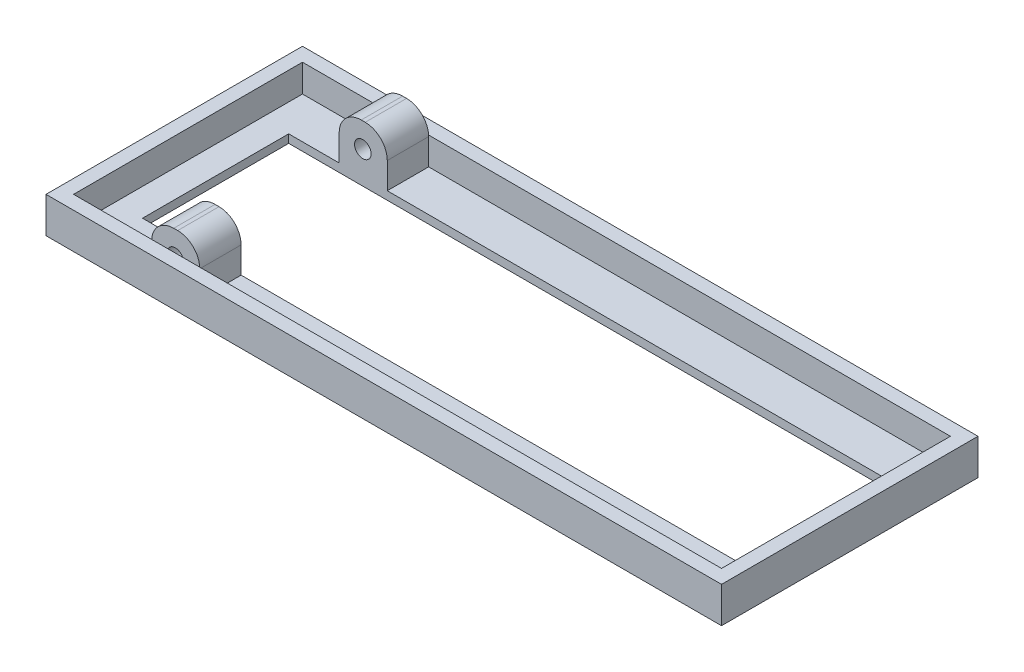
from build123d import *

# Parameters (mm, degrees)
SKETCH4_W               = 2449.5
SKETCH4_H               = 930
SKETCH4_W_2             = 2149.5
SKETCH4_H_2             = 530
BOSS_EXTRUDE2_DEPTH     = 30
SKETCH6_W               = 2449.5
SKETCH6_H               = 930
SKETCH6_W_2             = 2349.5
SKETCH6_H_2             = 830
BOSS_EXTRUDE3_DEPTH     = 100
SKETCH8_W               = 174.417097876
SKETCH8_H               = 150
BOSS_EXTRUDE4_DEPTH     = 175
CUT_EXTRUDE1_DEPTH      = 680
CUT_EXTRUDE1_DEPTH_BACK = 150
SKETCH10_R              = 30
FILLET1_R               = 80


with BuildPart() as part:
    # Sketch4 → Boss-Extrude2 (new body)
    with BuildSketch(Plane(origin=(0, 0, 0), x_dir=(1, 0, 0), z_dir=(0, 1, 0))):
        with Locations((2350.564429087, 865.22075714)):
            Rectangle(SKETCH4_W, SKETCH4_H)
        with Locations((2350.564429087, 865.22075714)):
            Rectangle(SKETCH4_W_2, SKETCH4_H_2, mode=Mode.SUBTRACT)
    extrude(amount=BOSS_EXTRUDE2_DEPTH)

    # Sketch6 → Boss-Extrude3 (add)
    with BuildSketch(Plane(origin=(0, 30, 0), x_dir=(1, 0, 0), z_dir=(0, 1, 0))):
        with Locations((2350.564429087, 865.22075714)):
            Rectangle(SKETCH6_W, SKETCH6_H)
        with Locations((2350.564429087, 865.22075714)):
            Rectangle(SKETCH6_W_2, SKETCH6_H_2, mode=Mode.SUBTRACT)
    extrude(amount=BOSS_EXTRUDE3_DEPTH)

    # Sketch8 → Boss-Extrude4 (add)
    with BuildSketch(Plane(origin=(0, 30, 0), x_dir=(1, 0, 0), z_dir=(0, 1, 0))):
        with Locations((1546.094821657, 1205.22075714)):
            Rectangle(SKETCH8_W, SKETCH8_H)
        with Locations((1546.094821657, 525.22075714)):
            Rectangle(SKETCH8_W, SKETCH8_H)
    extrude(amount=BOSS_EXTRUDE4_DEPTH)

    # Sketch10 → Cut-Extrude1 (cut, two sides: drawn at the far end of the back side and taken through both)
    with BuildSketch(Plane.XY.offset(-1130.22075714).offset(-CUT_EXTRUDE1_DEPTH_BACK)):
        with Locations(Location((1544.625999864, 116.419579706, 0), (0, 0, 180))):
            Circle(SKETCH10_R)
    extrude(amount=CUT_EXTRUDE1_DEPTH + CUT_EXTRUDE1_DEPTH_BACK, mode=Mode.SUBTRACT)

    # Fillet1
    # the kernel refuses this fillet: 80 mm, written as the material it takes off along each edge
    with BuildSketch(Plane(origin=(1633.303370595, 205, -1280.22075714), x_dir=(0, -1, 0), z_dir=(0, 0, 1)), Plane(origin=(1458.886272719, 205, -450.22075714), x_dir=(0, -1, 0), z_dir=(0, 0, -1))) as fillet1_piece_1:
        with BuildLine():
            CenterArc((FILLET1_R, -FILLET1_R), FILLET1_R, 90, 90)
            Line((0, -FILLET1_R), (0, 0))
            Line((0, 0), (FILLET1_R, 0))
        make_face()
    extrude(amount=350, mode=Mode.SUBTRACT)
    with BuildSketch(Plane(origin=(1458.886272719, 205, -930.22075714), x_dir=(1, 0, 0), z_dir=(0, 0, -1)), Plane(origin=(1633.303370595, 205, -800.22075714), x_dir=(-1, 0, 0), z_dir=(0, 0, 1))) as fillet1_piece_2:
        with BuildLine():
            CenterArc((FILLET1_R, FILLET1_R), FILLET1_R, 180, 90)
            Line((0, FILLET1_R), (0, 0))
            Line((0, 0), (FILLET1_R, 0))
        make_face()
    extrude(amount=350, mode=Mode.SUBTRACT)


solid = part.part
